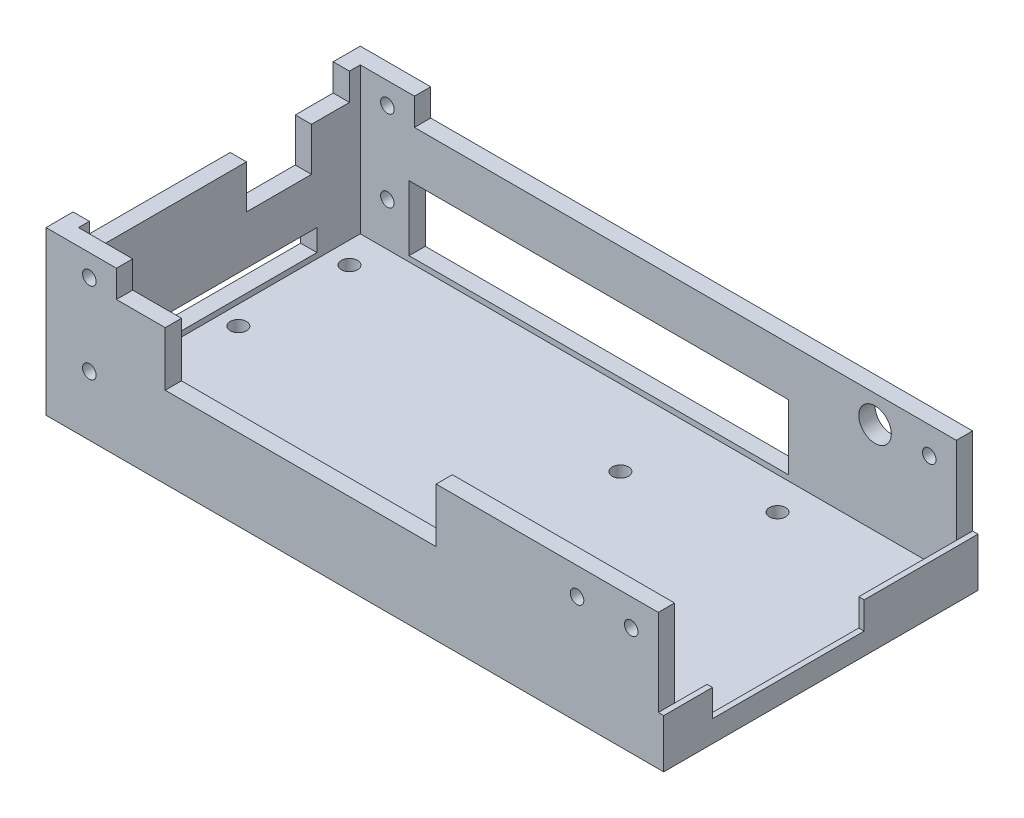
from build123d import *

# Parameters (mm, degrees)
SKETCH2_W           = 113
SKETCH2_H           = 58
BOSS_EXTRUDE1_DEPTH = 3
SKETCH3_R           = 1.5
CUT_EXTRUDE5_DEPTH  = 83.435544816
SKETCH5_R           = 3.025
CUT_EXTRUDE7_DEPTH  = 2.5
SKETCH7_W           = 3
SKETCH7_H           = 52
BOSS_EXTRUDE2_DEPTH = 22
CUT_EXTRUDE8_REACH  = 87.268
SKETCH8_R           = 1.5
CUT_EXTRUDE9_REACH  = 101.192
SKETCH9_W           = 50
SKETCH9_H           = 10
CUT_EXTRUDE10_REACH = 121.71
SKETCH10_W          = 32
SKETCH10_H          = 4
SKETCH10_W_2        = 12
SKETCH10_H_2        = 8
CUT_EXTRUDE11_REACH = 101.192
SKETCH11_W          = 70
SKETCH11_H          = 12
SKETCH12_R          = 1.25
CUT_EXTRUDE12_DEPTH = 100.192442304
SKETCH13_W          = 13
SKETCH13_H          = 5
BOSS_EXTRUDE4_DEPTH = 3
SKETCH14_W          = 13
SKETCH14_H          = 5
BOSS_EXTRUDE5_DEPTH = 3
SKETCH15_R          = 1.25
CUT_EXTRUDE13_DEPTH = 101.56908377
SKETCH16_W          = 2
SKETCH16_H          = 5
BOSS_EXTRUDE6_DEPTH = 3
CUT_EXTRUDE14_REACH = 100.869
SKETCH17_R          = 3
SKETCH19_W          = 1
SKETCH19_H          = 58
BOSS_EXTRUDE7_DEPTH = 9
CUT_EXTRUDE15_REACH = 123.789
SKETCH20_W          = 28
SKETCH20_H          = 5


with BuildPart() as part:
    # Sketch2 → Boss-Extrude1 (new body)
    with BuildSketch(Plane(origin=(0, 0, 0), x_dir=(1, 0, 0), z_dir=(0, 1, 0))):
        with Locations((-19.986211897, 1.601935214)):
            Rectangle(SKETCH2_W, SKETCH2_H)
    extrude(amount=BOSS_EXTRUDE1_DEPTH)

    # Sketch3 → Cut-Extrude5 (cut, through all)
    with BuildSketch(Plane(origin=(0, 3, 0), x_dir=(1, 0, 0), z_dir=(0, 1, 0))):
        with Locations((-11.486211897, 13.601935214)):
            Circle(SKETCH3_R)
        with Locations((-11.486211897, -10.398064786)):
            Circle(SKETCH3_R)
        with Locations((-69.986211897, 1.601935214)):
            Circle(SKETCH3_R)
    extrude(amount=-CUT_EXTRUDE5_DEPTH, mode=Mode.SUBTRACT)

    # Sketch5 → Cut-Extrude7 (cut)
    with BuildSketch(Plane(origin=(0, 0, 0), x_dir=(-1, 0, 0), z_dir=(0, -1, 0))):
        with Locations((24.486211897, 16.851935214)):
            Circle(SKETCH5_R)
        with Locations((24.486211897, -13.648064786)):
            Circle(SKETCH5_R)
        with Locations((54.986211897, -13.648064786)):
            Circle(SKETCH5_R)
        with Locations((54.986211897, 16.851935214)):
            Circle(SKETCH5_R)
    extrude(amount=-CUT_EXTRUDE7_DEPTH, mode=Mode.SUBTRACT)

    # Sketch7 → Boss-Extrude2 (add)
    with BuildSketch(Plane(origin=(0, 3, 0), x_dir=(1, 0, 0), z_dir=(0, 1, 0))):
        Polygon((36.513788103, 30.601935214), (-76.486211897, 30.601935214), (-76.486211897, 27.601935214), (-73.486211897, 27.601935214), (36.513788103, 27.601935214), align=None)
        with Locations((-74.986211897, 1.601935214)):
            Rectangle(SKETCH7_W, SKETCH7_H)
        Polygon((-73.486211897, -24.398064786), (-76.486211897, -24.398064786), (-76.486211897, -27.398064786), (36.513788103, -27.398064786), (36.513788103, -24.398064786), align=None)
    extrude(amount=BOSS_EXTRUDE2_DEPTH)

    # Sketch8 → Cut-Extrude8 (cut, up to next)
    with BuildSketch(Plane(origin=(0, 3, 0), x_dir=(1, 0, 0), z_dir=(0, 1, 0)), mode=Mode.PRIVATE) as cut_extrude8_sk1:
        with Locations((-69.486211897, 21.601935214)):
            Circle(SKETCH8_R)
    cut_extrude8_tool1 = extrude(cut_extrude8_sk1.sketch, amount=-CUT_EXTRUDE8_REACH, mode=Mode.PRIVATE) & part.part
    # Sketch8 → Cut-Extrude8 (cut, up to next)
    with BuildSketch(Plane(origin=(0, 3, 0), x_dir=(1, 0, 0), z_dir=(0, 1, 0)), mode=Mode.PRIVATE) as cut_extrude8_sk2:
        with Locations((-69.486211897, -20.398064786)):
            Circle(SKETCH8_R)
    cut_extrude8_tool2 = extrude(cut_extrude8_sk2.sketch, amount=-CUT_EXTRUDE8_REACH, mode=Mode.PRIVATE) & part.part
    # Sketch8 → Cut-Extrude8 (cut, up to next)
    with BuildSketch(Plane(origin=(0, 3, 0), x_dir=(1, 0, 0), z_dir=(0, 1, 0)), mode=Mode.PRIVATE) as cut_extrude8_sk3:
        with Locations((9.513788103, 21.601935214)):
            Circle(SKETCH8_R)
    cut_extrude8_tool3 = extrude(cut_extrude8_sk3.sketch, amount=-CUT_EXTRUDE8_REACH, mode=Mode.PRIVATE) & part.part
    # Sketch8 → Cut-Extrude8 (cut, up to next)
    with BuildSketch(Plane(origin=(0, 3, 0), x_dir=(1, 0, 0), z_dir=(0, 1, 0)), mode=Mode.PRIVATE) as cut_extrude8_sk4:
        with Locations((9.513788103, -20.398064786)):
            Circle(SKETCH8_R)
    cut_extrude8_tool4 = extrude(cut_extrude8_sk4.sketch, amount=-CUT_EXTRUDE8_REACH, mode=Mode.PRIVATE) & part.part
    add(cut_extrude8_tool1.solids().sort_by_distance((-69.486212, 3, -21.601935))[0], mode=Mode.SUBTRACT)
    add(cut_extrude8_tool2.solids().sort_by_distance((-69.486212, 3, 20.398065))[0], mode=Mode.SUBTRACT)
    add(cut_extrude8_tool3.solids().sort_by_distance((9.513788, 3, -21.601935))[0], mode=Mode.SUBTRACT)
    add(cut_extrude8_tool4.solids().sort_by_distance((9.513788, 3, 20.398065))[0], mode=Mode.SUBTRACT)

    # Sketch9 → Cut-Extrude9 (cut, up to next)
    with BuildSketch(Plane.XY.offset(27.398064786), mode=Mode.PRIVATE) as cut_extrude9_sk1:
        with Locations((-29.486211897, 20)):
            Rectangle(SKETCH9_W, SKETCH9_H)
    cut_extrude9_tool1 = extrude(cut_extrude9_sk1.sketch, amount=-CUT_EXTRUDE9_REACH, mode=Mode.PRIVATE) & part.part
    add(cut_extrude9_tool1.solids().sort_by_distance((-29.486212, 20, 27.398065))[0], mode=Mode.SUBTRACT)

    # Sketch10 → Cut-Extrude10 (cut, up to next)
    with BuildSketch(Plane.ZY.offset(76.486211897), mode=Mode.PRIVATE) as cut_extrude10_sk1:
        with Locations((-3.601935214, 6)):
            Rectangle(SKETCH10_W, SKETCH10_H)
    cut_extrude10_tool1 = extrude(cut_extrude10_sk1.sketch, amount=-CUT_EXTRUDE10_REACH, mode=Mode.PRIVATE) & part.part
    # Sketch10 → Cut-Extrude10 (cut, up to next)
    with BuildSketch(Plane.ZY.offset(76.486211897), mode=Mode.PRIVATE) as cut_extrude10_sk2:
        with Locations((-12.601935214, 21)):
            Rectangle(SKETCH10_W_2, SKETCH10_H_2)
    cut_extrude10_tool2 = extrude(cut_extrude10_sk2.sketch, amount=-CUT_EXTRUDE10_REACH, mode=Mode.PRIVATE) & part.part
    add(cut_extrude10_tool1.solids().sort_by_distance((-76.486212, 6, -3.601935))[0], mode=Mode.SUBTRACT)
    add(cut_extrude10_tool2.solids().sort_by_distance((-76.486212, 21, -12.601935))[0], mode=Mode.SUBTRACT)

    # Sketch11 → Cut-Extrude11 (cut, up to next)
    with BuildSketch(Plane(origin=(0, 0, -30.601935214), x_dir=(-1, 0, 0), z_dir=(0, 0, -1)), mode=Mode.PRIVATE) as cut_extrude11_sk1:
        with Locations((29.486211897, 10)):
            Rectangle(SKETCH11_W, SKETCH11_H)
    cut_extrude11_tool1 = extrude(cut_extrude11_sk1.sketch, amount=-CUT_EXTRUDE11_REACH, mode=Mode.PRIVATE) & part.part
    add(cut_extrude11_tool1.solids().sort_by_distance((-29.486212, 10, -30.601935))[0], mode=Mode.SUBTRACT)

    # Sketch12 → Cut-Extrude12 (cut, through all)
    with BuildSketch(Plane.XY.offset(27.398064786)):
        with Locations((21.513788103, 20)):
            Circle(SKETCH12_R)
        with Locations((31.513788103, 20)):
            Circle(SKETCH12_R)
        with Locations((-68.488300827, 11)):
            Circle(SKETCH12_R)
    extrude(amount=-CUT_EXTRUDE12_DEPTH, mode=Mode.SUBTRACT)

    # Sketch13 → Boss-Extrude4 (add)
    with BuildSketch(Plane.XY.offset(27.398064786)):
        with Locations((-69.986211897, 27.5)):
            Rectangle(SKETCH13_W, SKETCH13_H)
    extrude(amount=-BOSS_EXTRUDE4_DEPTH)

    # Sketch14 → Boss-Extrude5 (add)
    with BuildSketch(Plane(origin=(0, 0, -30.601935214), x_dir=(-1, 0, 0), z_dir=(0, 0, -1))):
        with Locations((69.986211897, 27.5)):
            Rectangle(SKETCH14_W, SKETCH14_H)
    extrude(amount=-BOSS_EXTRUDE5_DEPTH)

    # Sketch15 → Cut-Extrude13 (cut, through all)
    with BuildSketch(Plane.XY.offset(27.398064786)):
        with Locations((-68.486211897, 26)):
            Circle(SKETCH15_R)
    extrude(amount=-CUT_EXTRUDE13_DEPTH, mode=Mode.SUBTRACT)

    # Sketch16 → Boss-Extrude6 (add)
    with BuildSketch(Plane.ZY.offset(76.486211897)):
        with Locations((-26.601935214, 27.5)):
            Rectangle(SKETCH16_W, SKETCH16_H)
        with Locations((23.398064786, 27.5)):
            Rectangle(SKETCH16_W, SKETCH16_H)
    extrude(amount=-BOSS_EXTRUDE6_DEPTH)

    # Sketch17 → Cut-Extrude14 (cut, up to next)
    with BuildSketch(Plane.XY.offset(-27.601935214), mode=Mode.PRIVATE) as cut_extrude14_sk1:
        with Locations((21.513788103, 20)):
            Circle(SKETCH17_R)
    cut_extrude14_tool1 = extrude(cut_extrude14_sk1.sketch, amount=-CUT_EXTRUDE14_REACH, mode=Mode.PRIVATE) & part.part
    add(cut_extrude14_tool1.solids().sort_by_distance((21.513788, 20, -27.601935))[0], mode=Mode.SUBTRACT)

    # Sketch19 → Boss-Extrude7 (add)
    with BuildSketch(Plane.XZ):
        with Locations((37.013788103, -1.601935214)):
            Rectangle(SKETCH19_W, SKETCH19_H)
    extrude(amount=-BOSS_EXTRUDE7_DEPTH)

    # Sketch20 → Cut-Extrude15 (cut, up to next)
    with BuildSketch(Plane(origin=(37.513788103, 0, 0), x_dir=(0, 0, -1), z_dir=(1, 0, 0)), mode=Mode.PRIVATE) as cut_extrude15_sk1:
        with Locations((-4.398064786, 6.5)):
            Rectangle(SKETCH20_W, SKETCH20_H)
    cut_extrude15_tool1 = extrude(cut_extrude15_sk1.sketch, amount=-CUT_EXTRUDE15_REACH, mode=Mode.PRIVATE) & part.part
    add(cut_extrude15_tool1.solids().sort_by_distance((37.513788, 6.5, 4.398065))[0], mode=Mode.SUBTRACT)


solid = part.part
